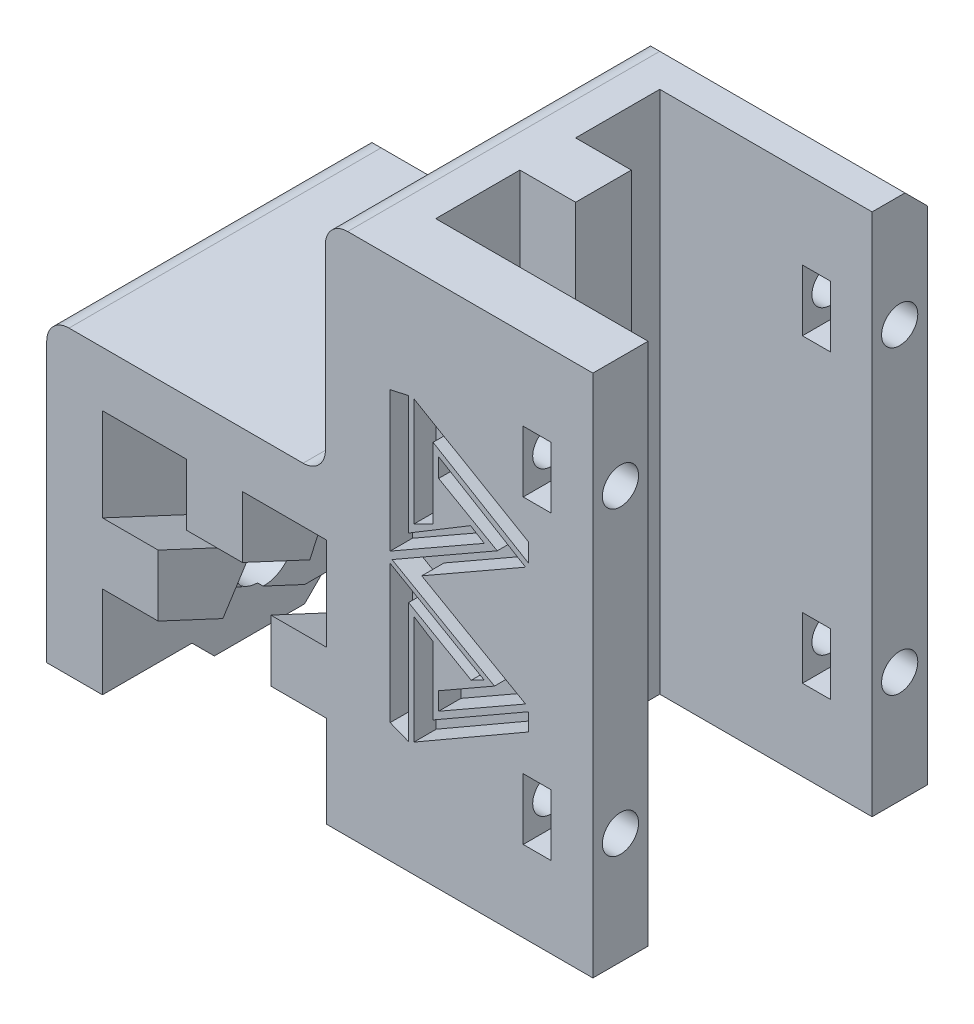
from build123d import *

# Parameters (mm, degrees)
SKETCH1_W                       = 30
SKETCH1_H                       = 30
BOSS_EXTRUDE1_DEPTH             = 50
CUT_EXTRUDE1_DEPTH              = 55.313902456
SKETCH3_W                       = 6
SKETCH3_H                       = 30
CUT_EXTRUDE2_DEPTH              = 55.313902456
SKETCH5_W                       = 30
SKETCH5_H                       = 30
BOSS_EXTRUDE2_DEPTH             = 25
F_45_DEGREE_EXTRUSION_CUT_DEPTH = 73.926037689
SKETCH11_R                      = 1.625
CUT_EXTRUDE7_DEPTH              = 10
CHAMFER1_SIZE                   = 2
FILLET1_R                       = 2
SKETCH16_R                      = 2.675
CUT_EXTRUDE10_DEPTH             = 10
CUT_EXTRUDE11_DEPTH             = 9.5
FILLET2_R                       = 0.5
FILLET3_R                       = 0.5
SKETCH19_W                      = 49
SKETCH19_H                      = 3
CUT_EXTRUDE12_DEPTH             = 71.710678119
SKETCH20_W                      = 6.753728314
SKETCH20_H                      = 6.253099935
CUT_EXTRUDE13_DEPTH             = 15
SKETCH22_R                      = 2.65
CUT_EXTRUDE14_DEPTH             = 51.035604398
SKETCH23_R                      = 5
CUT_EXTRUDE15_DEPTH             = 2.5
SKETCH24_W                      = 5
SKETCH24_H                      = 15
CUT_EXTRUDE16_DEPTH             = 4
SKETCH25_W                      = 5
SKETCH25_H                      = 12.094379765
BOSS_EXTRUDE3_DEPTH             = 2
CHAMFER2_SIZE                   = 2
SKETCH26_W                      = 2.5
SKETCH26_H                      = 5.5
CUT_EXTRUDE17_DEPTH             = 71.710678119
FILLET4_R                       = 0.5
CUT_EXTRUDE18_DEPTH             = 2


with BuildPart() as part:
    # Sketch1 → Boss-Extrude1 (new body)
    with BuildSketch(Plane(origin=(0, 0, 0), x_dir=(1, 0, 0), z_dir=(0, 1, 0))):
        Rectangle(SKETCH1_W, SKETCH1_H)
    extrude(amount=BOSS_EXTRUDE1_DEPTH)

    # Sketch2 → Cut-Extrude1 (cut, through all)
    with BuildSketch(Plane(origin=(0, 50, 0), x_dir=(1, 0, 0), z_dir=(0, 1, 0))):
        Polygon((-10.05, -2.5), (-10.05, -10.05), (10.05, -10.05), (10.05, 10.05), (-10.05, 10.05), (-10.05, 2.5), (-5.05, 2.5), (-5.05, -2.5), align=None)
    extrude(amount=-CUT_EXTRUDE1_DEPTH, mode=Mode.SUBTRACT)

    # Sketch3 → Cut-Extrude2 (cut, through all)
    with BuildSketch(Plane(origin=(0, 50, 0), x_dir=(1, 0, 0), z_dir=(0, 1, 0))):
        with Locations((12, 0)):
            Rectangle(SKETCH3_W, SKETCH3_H)
    extrude(amount=-CUT_EXTRUDE2_DEPTH, mode=Mode.SUBTRACT)

    # Sketch5 → Boss-Extrude2 (add)
    with BuildSketch(Plane.ZY.offset(15)):
        with Locations((0, 15)):
            Rectangle(SKETCH5_W, SKETCH5_H)
    extrude(amount=BOSS_EXTRUDE2_DEPTH)

    # Sketch7 → 45 degree extrusion cut (cut, through all)
    with BuildSketch(Plane(origin=(-40, 12.069825676, -23.451382923), x_dir=(-1, 0, 0), z_dir=(0, -0.42261826174069717, -0.9063077870366509))):
        Polygon((-25.1, -17.010685759), (-25.1, -24.560685759), (-17.55, -24.560685759), (-17.55, -19.560685759), (-12.55, -19.560685759), (-12.55, -24.560685759), (-5, -24.560685759), (-5, -17.010685759), (-10, -17.010685759), (-10, -14.510685759), (-20.1, -14.510685759), (-20.1, -17.010685759), align=None)
        Polygon((-25.1, -4.460685759), (-25.1, -12.010685759), (-20.1, -12.010685759), (-20.1, -14.510685759), (-10, -14.510685759), (-10, -12.010685759), (-5, -12.010685759), (-5, -4.460685759), (-12.55, -4.460685759), (-12.55, -9.460685759), (-17.55, -9.460685759), (-17.55, -4.460685759), align=None)
    extrude(amount=-F_45_DEGREE_EXTRUSION_CUT_DEPTH, mode=Mode.SUBTRACT)

    # Sketch11 → Cut-Extrude7 (cut)
    with BuildSketch(Plane(origin=(9, 0, 0), x_dir=(0, 0, -1), z_dir=(1, 0, 0))):
        with Locations((-12.525, 40)):
            Circle(SKETCH11_R)
        with Locations((12.525, 40)):
            Circle(SKETCH11_R)
        with Locations((12.525, 13)):
            Circle(SKETCH11_R)
        with Locations((-12.525, 13)):
            Circle(SKETCH11_R)
    extrude(amount=-CUT_EXTRUDE7_DEPTH, mode=Mode.SUBTRACT)

    # Chamfer1
    chamfer1_edges = [part.edges().sort_by_distance(p)[0] for p in [
        (-5.45, 0, -15),
        (-3, 50, -15),
        (-27.5, 30, -15),
        (-40, 15, -15),
        (-15, 40, -15),
        (-35, 0, -15),
    ]]
    chamfer(chamfer1_edges, length=CHAMFER1_SIZE)

    # Fillet1
    fillet1_edges = [part.edges().sort_by_distance(p)[0] for p in [
        (-15, 50, 1),
        (-15, 30, 1),
        (-40, 30, 1),
        (-40, 0, 1),
    ]]
    fillet(fillet1_edges, radius=FILLET1_R)

    # Sketch16 → Cut-Extrude10 (cut)
    with BuildSketch(Plane.ZY.offset(40)):
        with Locations((1, 7.415122828)):
            Circle(SKETCH16_R)
    extrude(amount=-CUT_EXTRUDE10_DEPTH, mode=Mode.SUBTRACT)

    # Sketch18 → Cut-Extrude11 (cut, symmetric)
    with BuildSketch(Plane.ZY.offset(25)):
        Polygon((9.950685103, 7.347750191), (5.606439218, 14.127716409), (-7.950685103, 7.482495466), (-3.606439218, 0.702529248), align=None)
    extrude(amount=CUT_EXTRUDE11_DEPTH, both=True, mode=Mode.SUBTRACT)

    # Fillet2
    fillet2_edges = [part.edges().sort_by_distance(p)[0] for p in [
        (-24.95, 0, -3.050682005),
    ]]
    fillet(fillet2_edges, radius=FILLET2_R)

    # Fillet3
    fillet3_edges = [part.edges().sort_by_distance(p)[0] for p in [
        (-24.95, 8.417171254, 15),
    ]]
    fillet(fillet3_edges, radius=FILLET3_R)

    # Sketch19 → Cut-Extrude12 (cut, through all)
    with BuildSketch(Plane.XY.offset(15)):
        with Locations((-15.5, 1.5)):
            Rectangle(SKETCH19_W, SKETCH19_H)
    extrude(amount=-CUT_EXTRUDE12_DEPTH, mode=Mode.SUBTRACT)


with BuildPart() as cut_extrude12_piece_1:
    # of the separate pieces the step leaves, piece 1, a body of its own (cut_extrude12_pieces)
    add(part.part.solids().sort_by_distance((-14.9, 3, 15))[0])

    # Sketch22 → Cut-Extrude14 (cut, through all)
    with BuildSketch(Plane(origin=(-25, 31.908299393, -7.624586929), x_dir=(1, 0, 0), z_dir=(3.142436568436473e-15, 0.8851034809979968, -0.46539427147874146))):
        with Locations(Location((0.022023463, 0.014340274, 0), (0, 0, 201.118214674))):
            Circle(SKETCH22_R)
    extrude(amount=-CUT_EXTRUDE14_DEPTH, mode=Mode.SUBTRACT)

    # Sketch23 → Cut-Extrude15 (cut)
    with BuildSketch(Plane(origin=(-25, 31.908299393, -7.624586929), x_dir=(1, 0, 0), z_dir=(3.142436568436473e-15, 0.8851034809979968, -0.46539427147874146))):
        with Locations((0.022023463, 0.014340274)):
            Circle(SKETCH23_R)
    extrude(amount=-CUT_EXTRUDE15_DEPTH, mode=Mode.SUBTRACT)

    # Sketch24 → Cut-Extrude16 (cut)
    with BuildSketch(Plane(origin=(0, 10.322187648, -4.813315149), x_dir=(1, 0, 0), z_dir=(0, -0.906307787036651, 0.4226182617406971))):
        with Locations((-24.95, 7.684747226)):
            Rectangle(SKETCH24_W, SKETCH24_H)
    extrude(amount=-CUT_EXTRUDE16_DEPTH, mode=Mode.SUBTRACT)

    # Sketch25 → Boss-Extrude3 (add)
    with BuildSketch(Plane.XZ.offset(-3)):
        with Locations((-37.5, 0.91772931)):
            Rectangle(SKETCH25_W, SKETCH25_H)
    extrude(amount=BOSS_EXTRUDE3_DEPTH)

    # Chamfer2
    chamfer2_edges = [cut_extrude12_piece_1.edges().sort_by_distance(p)[0] for p in [
        (-37.5, 1, -5.129460572),
        (-37.5, 1, 6.964919193),
    ]]
    chamfer(chamfer2_edges, length=CHAMFER2_SIZE - 0.0001)  # a hair under: the kernel refuses the full size

    # Sketch26 → Cut-Extrude17 (cut, through all)
    with BuildSketch(Plane.XY.offset(15)):
        with Locations((4, 40)):
            Rectangle(SKETCH26_W, SKETCH26_H)
        with Locations((4, 13)):
            Rectangle(SKETCH26_W, SKETCH26_H)
    extrude(amount=-CUT_EXTRUDE17_DEPTH, mode=Mode.SUBTRACT)

    # Fillet4
    fillet4_edges = [cut_extrude12_piece_1.edges().sort_by_distance(p)[0] for p in [
        (-32.5, 3, -14.481983196),
        (-24.95, 5.572058491, -15),
        (-17.4, 3, -14.481983196),
    ]]
    fillet(fillet4_edges, radius=FILLET4_R)

    # Mobious Logo → Cut-Extrude18 (cut)
    with BuildSketch(Plane(origin=(0, 0, 15), x_dir=(-1, 0, 0), z_dir=(0, 0, 1))):
        Polygon((-3.210868628, -32.348650408), (-3.210868628, -34.003716414), (7.056151005, -39.978785217), (7.056151005, -30.244752942), (5.33825141, -31.122174097), (5.33825141, -37.454108258), align=None)
        Polygon((1.978745121, -32.657222036), (0.744458608, -31.899818949), (9.188100437, -27.07488076), (9.188100437, -39.614109657), (7.533034431, -39.985072727), (7.533034431, -29.307901849), align=None)
        Polygon((4.840045674, -36.584497306), (-2.958400932, -31.899818949), (6.355467669, -26.569945368), (-2.958400932, -21.268123754), (4.840045674, -16.805452407), (4.840045674, -18.400245934), (-0.171524822, -21.268123754), (9.019468658, -26.5), (-0.416628352, -31.899818949), (4.840045674, -34.892125279), align=None)
        Polygon((-3.210868628, -20.791240329), (-3.210868628, -19.220330221), (7.056151005, -13.30136535), (7.056151005, -23.063449592), (5.33825141, -21.96942291), (5.33825141, -15.882146242), align=None)
        Polygon((0.744458608, -21.268123754), (9.188100437, -26.121113909), (9.188100437, -13.75019681), (7.533034431, -13.093877531), (7.533034431, -23.905008578), (1.915732347, -20.67645954), align=None)
    extrude(amount=-CUT_EXTRUDE18_DEPTH, mode=Mode.SUBTRACT)


with BuildPart() as cut_extrude12_piece_2:
    # of the separate pieces the step leaves, piece 2, a body of its own (cut_extrude12_pieces)
    add(part.part.solids().sort_by_distance((-27.45, 3, 15))[0])

    # Sketch20 → Cut-Extrude13 (cut)
    with BuildSketch(Plane.XY.offset(15)):
        with Locations((-25.201643275, 5.301831254)):
            Rectangle(SKETCH20_W, SKETCH20_H)
    extrude(amount=-CUT_EXTRUDE13_DEPTH, mode=Mode.SUBTRACT)


solid = cut_extrude12_piece_1.part
